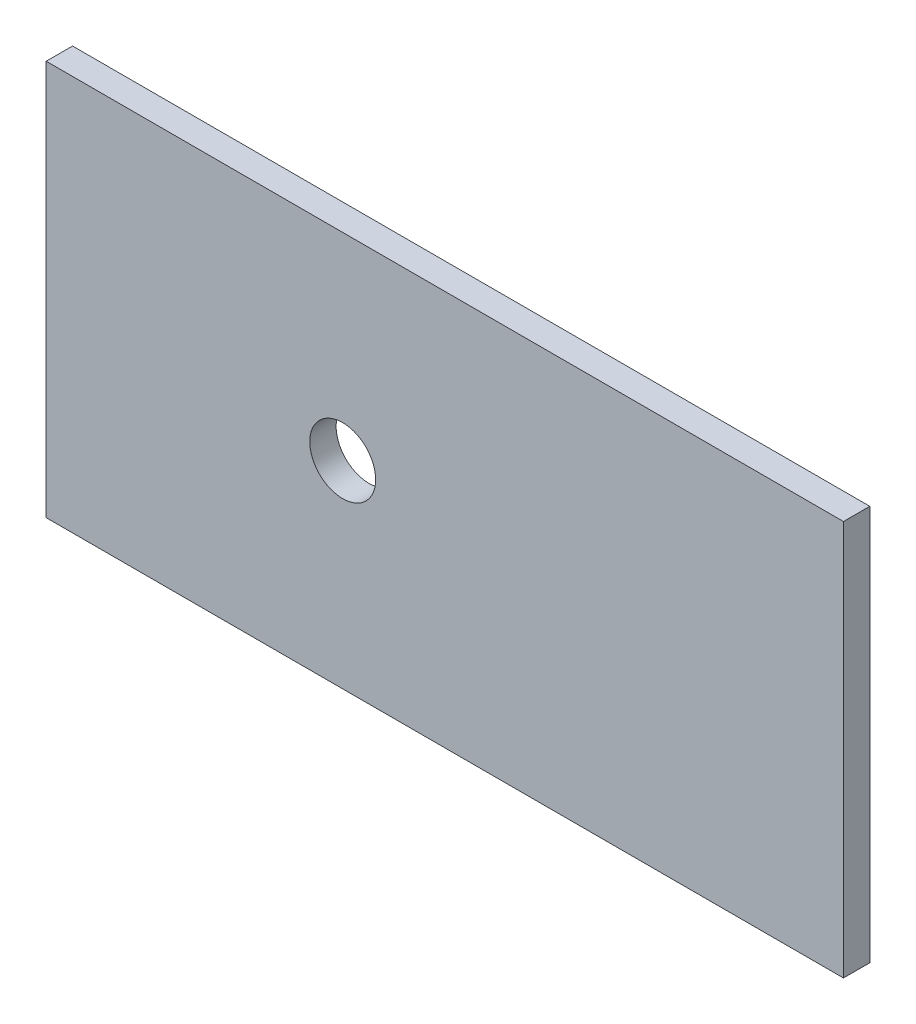
from build123d import *

# Parameters (mm, degrees)
SKETCH1_W           = 121
SKETCH1_H           = 60
SKETCH1_R           = 5
BOSS_EXTRUDE1_DEPTH = 4


with BuildPart() as part:
    # Sketch1 → Boss-Extrude1 (new body)
    with BuildSketch(Plane.XY):
        with Locations((-20.5, 0)):
            Rectangle(SKETCH1_W, SKETCH1_H)
        with Locations((-36, 0)):
            Circle(SKETCH1_R, mode=Mode.SUBTRACT)
    extrude(amount=BOSS_EXTRUDE1_DEPTH)


solid = part.part
